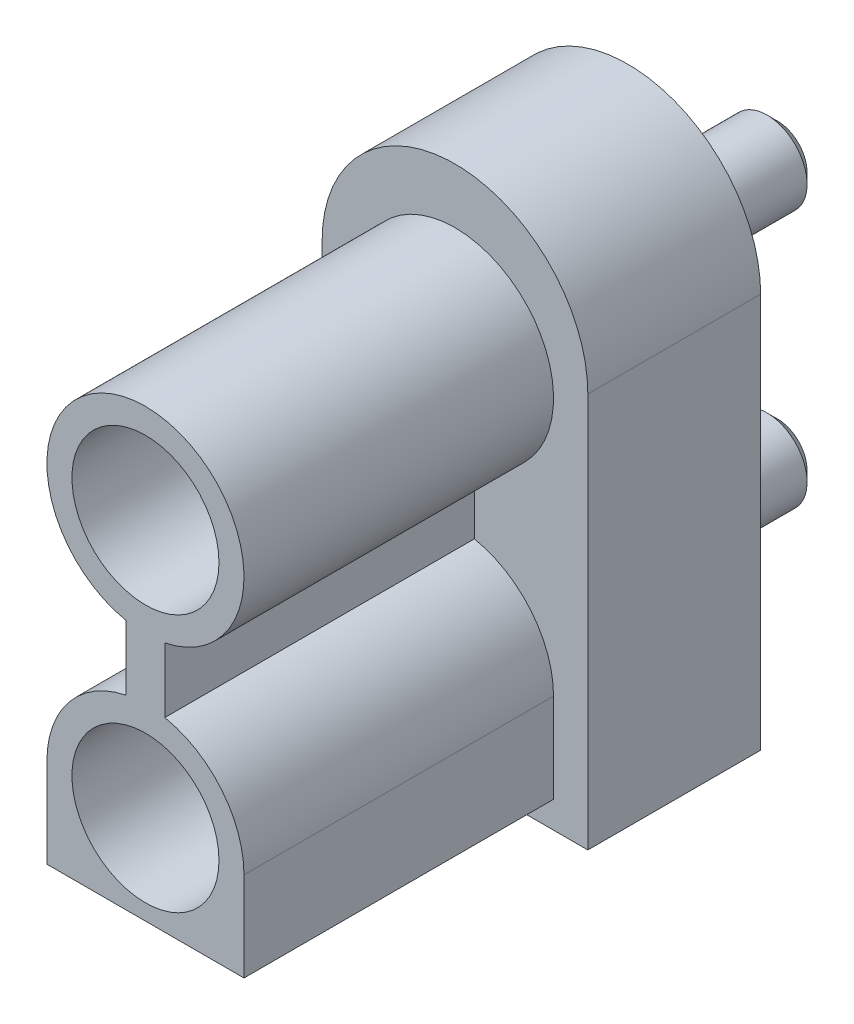
from build123d import *

# Parameters (mm, degrees)
SALIENTE_EXTRUIR1_DEPTH = 3.35
CROQUIS2_R              = 0.775
SALIENTE_EXTRUIR2_DEPTH = 2.9
CHAFL_N1_SIZE           = 0.2
CROQUIS3_R              = 1.425
SALIENTE_EXTRUIR3_DEPTH = 6


with BuildPart() as part:
    # Croquis1 → Saliente-Extruir1 (new body)
    with BuildSketch(Plane.XY):
        with BuildLine():
            Line((-2.575, 7.655), (-2.575, 0))
            Line((-2.575, 0), (2.575, 0))
            Line((2.575, 0), (2.575, 7.655))
            ThreePointArc((2.575, 7.655), (0, 10.23), (-2.575, 7.655))
        make_face()
    extrude(amount=SALIENTE_EXTRUIR1_DEPTH)

    # Croquis2 → Saliente-Extruir2 (add)
    with BuildSketch(Plane(origin=(0, 0, 0), x_dir=(-1, 0, 0), z_dir=(0, 0, -1))):
        with Locations((0, 7.25)):
            Circle(CROQUIS2_R)
        with Locations((0, 2.25)):
            Circle(CROQUIS2_R)
    extrude(amount=SALIENTE_EXTRUIR2_DEPTH)

    # Chaflán1
    chafl_n1_edges = [part.edges().sort_by_distance(p)[0] for p in [
        (0.775, 2.25, -2.9),
        (0.775, 7.25, -2.9),
    ]]
    chamfer(chafl_n1_edges, length=CHAFL_N1_SIZE)

    # Croquis3 → Saliente-Extruir3 (add)
    with BuildSketch(Plane.XY.offset(3.35)):
        with BuildLine():
            Line((-1.91, 2.25), (-1.91, 0.51859855))
            Line((-1.91, 0.51859855), (1.91, 0.51859855))
            Line((1.91, 0.51859855), (1.91, 2.25))
            ThreePointArc((1.91, 2.25), (1.47721867, 3.460753897), (0.375, 4.122825406))
            Line((0.375, 4.122825406), (0.375, 5.377174594))
            ThreePointArc((0.375, 5.377174594), (0, 9.16), (-0.375, 5.377174594))
            Line((-0.375, 5.377174594), (-0.375, 4.122825406))
            ThreePointArc((-0.375, 4.122825406), (-1.47721867, 3.460753897), (-1.91, 2.25))
        make_face()
        with Locations((0, 2.25)):
            Circle(CROQUIS3_R, mode=Mode.SUBTRACT)
        with Locations((0, 7.25)):
            Circle(CROQUIS3_R, mode=Mode.SUBTRACT)
    extrude(amount=SALIENTE_EXTRUIR3_DEPTH)


solid = part.part
